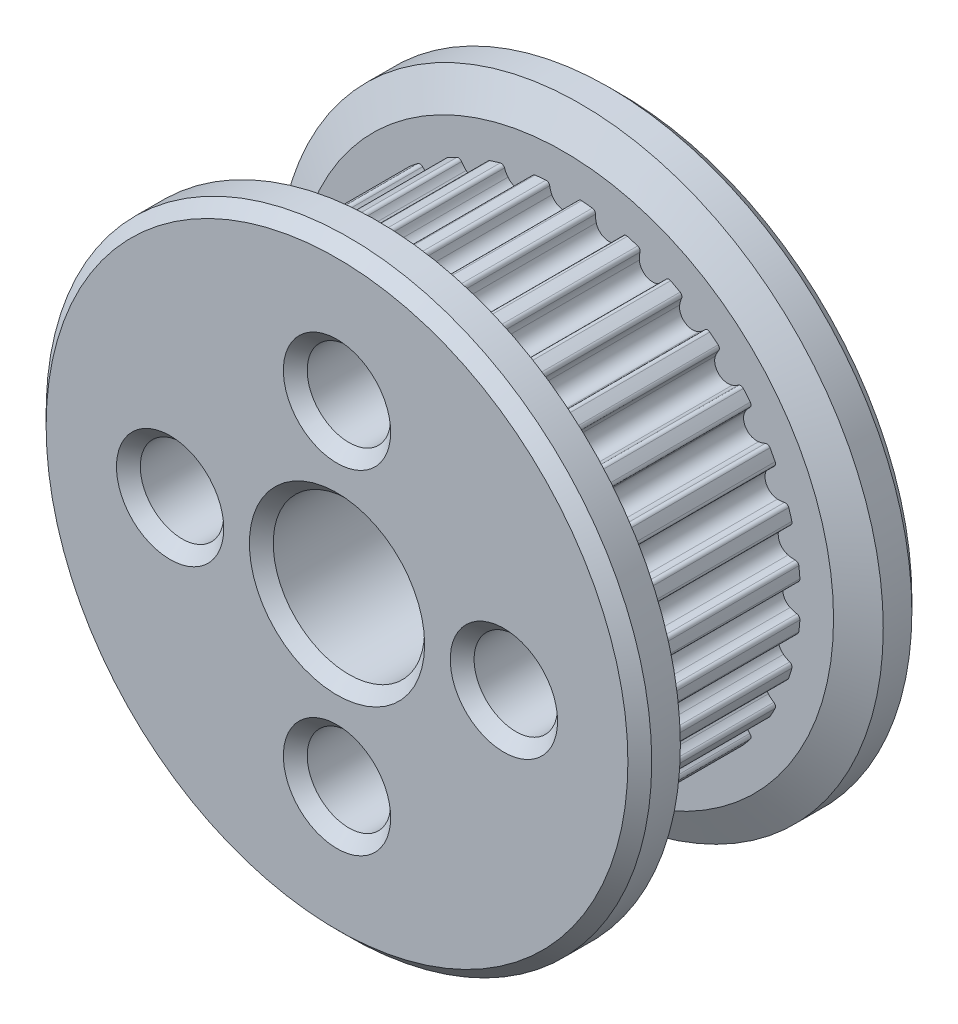
from build123d import *

# Parameters (mm, degrees)
CUT_EXTRUDE1_START  = -0.2149
CUT_EXTRUDE1_DEPTH  = 7.11
CIRPATTERN1_COUNT   = 32
SKETCH4_R           = 1.7526
CUT_EXTRUDE2_DEPTH  = 20.967570709
CUT_EXTRUDE3_DEPTH  = 1.31445
CIRPATTERN2_COUNT   = 2
CIRPATTERN2_ANGLE   = 90
CHAMFER1_SIZE       = 0.37975
SKETCH7_R           = 7.595
CUT_EXTRUDE4_DEPTH  = 21.51312024
SKETCH8_R           = 1.75
CUT_EXTRUDE5_DEPTH  = 21.513120192
BOSS_EXTRUDE1_START = 1
SKETCH9_R           = 12.7
SKETCH9_R_2         = 1.75
SKETCH9_R_3         = 3.175
BOSS_EXTRUDE1_DEPTH = 1
CHAMFER2_SIZE       = 0.5


with BuildPart() as part:
    # Sketch2 → Revolve1 (revolve)
    with BuildSketch(Plane(origin=(0, 0, 0), x_dir=(0, 0, -1), z_dir=(1, 0, 0)), mode=Mode.PRIVATE) as revolve1_sk:
        Polygon((-8.7249, 3.175), (8.7249, 3.175), (8.7249, 12.7), (8.0249, 12.7), (7.3249, 11.31575), (7.3249, 9.9315), (0.2149, 9.9315), (0.2149, 11.31575), (-0.4851, 12.7), (-1.1851, 12.7), (-1.1851, 7.595), (-8.7249, 7.595), align=None)
    revolve(revolve1_sk.sketch.rotate(Axis((0, 0, 8.7249), (0, 0, -1)), 90), axis=Axis((0, 0, 8.7249), (0, 0, -1)))

    # Sketch3 → Cut-Extrude1 (cut)
    with BuildSketch(Plane.XY.offset(CUT_EXTRUDE1_START)):
        with BuildLine():
            Line((2.530476216, 12.7), (-2.530476216, 12.7))
            Line((-2.530476216, 12.7), (-1.940703719, 9.740039082))
            ThreePointArc((-1.940703719, 9.740039082), (-1.346564619, 9.839789427), (-0.747470493, 9.903331768))
            ThreePointArc((-0.747470493, 9.903331768), (-0.643016659, 9.871317346), (-0.587983568, 9.776941049))
            ThreePointArc((-0.587983568, 9.776941049), (-0.554030146, 9.631789337), (-0.498876404, 9.493297753))
            ThreePointArc((-0.498876404, 9.493297753), (0, 9.1815), (0.498876404, 9.493297753))
            ThreePointArc((0.498876404, 9.493297753), (0.554030146, 9.631789337), (0.587983568, 9.776941049))
            ThreePointArc((0.587983568, 9.776941049), (0.643016659, 9.871317346), (0.747470493, 9.903331768))
            ThreePointArc((0.747470493, 9.903331768), (1.346564619, 9.839789427), (1.940703719, 9.740039082))
            Line((1.940703719, 9.740039082), (2.530476216, 12.7))
        make_face()
    cut_extrude1 = extrude(amount=-CUT_EXTRUDE1_DEPTH, mode=Mode.SUBTRACT)

    # CirPattern1: Cut-Extrude1 ×32 about axis
    cirpattern1_axis = Axis((0, 0, 0), (0, 0, 1))
    for i in range(1, CIRPATTERN1_COUNT):
        add(cut_extrude1.rotate(cirpattern1_axis, i * 360 / CIRPATTERN1_COUNT), mode=Mode.SUBTRACT)

    # Sketch4 → Cut-Extrude2 (cut, through all)
    with BuildSketch(Plane(origin=(0, 0, 0), x_dir=(0, -1, 0), z_dir=(1, 0, 0))):
        with Locations(Location((0, -4.955, 0), (0, 0, 270.000000003))):
            Circle(SKETCH4_R)
    cut_extrude2 = extrude(amount=CUT_EXTRUDE2_DEPTH, mode=Mode.SUBTRACT)

    # Sketch5 → Revolve2 (revolve)
    with BuildSketch(Plane.XY.offset(4.955), mode=Mode.PRIVATE) as revolve2_sk:
        Polygon((3.175, -1.3716), (3.175, 0), (7.390021532, 0), (7.390021532, -1.3716), (7.009021532, -1.7526), (3.556, -1.7526), align=None)
    revolve2 = revolve(revolve2_sk.sketch.rotate(Axis((3.175, 0, 4.955), (1, 0, 0)), 270), axis=Axis((3.175, 0, 4.955), (1, 0, 0)))

    # Sketch6 → Cut-Extrude3 (cut)
    with BuildSketch(Plane(origin=(7.390021532, 5.384140679, 0), x_dir=(0, -1, 0), z_dir=(-1, 0, 0))):
        Polygon((5.384140679, 5.966864082), (4.507840679, 5.460932041), (4.507840679, 4.449067959), (5.384140679, 3.943135918), (6.260440679, 4.449067959), (6.260440679, 5.460932041), align=None)
    cut_extrude3 = extrude(amount=CUT_EXTRUDE3_DEPTH, mode=Mode.SUBTRACT)

    # CirPattern2: Cut-Extrude2, Revolve2, Cut-Extrude3 ×2 about axis
    cirpattern2_axis = Axis((0, 0, 0), (0, 0, 1))
    add([cut_extrude2.rotate(cirpattern2_axis, i * CIRPATTERN2_ANGLE / (CIRPATTERN2_COUNT - 1)) for i in range(1, CIRPATTERN2_COUNT)], mode=Mode.SUBTRACT)
    add([revolve2.rotate(cirpattern2_axis, i * CIRPATTERN2_ANGLE / (CIRPATTERN2_COUNT - 1)) for i in range(1, CIRPATTERN2_COUNT)])
    add([cut_extrude3.rotate(cirpattern2_axis, i * CIRPATTERN2_ANGLE / (CIRPATTERN2_COUNT - 1)) for i in range(1, CIRPATTERN2_COUNT)], mode=Mode.SUBTRACT)

    # Chamfer1
    chamfer1_edges = [part.edges().sort_by_distance(p)[0] for p in [
        (-7.595, 0, 8.7249),
        (-3.175, 0, 8.7249),
    ]]
    chamfer(chamfer1_edges, length=CHAMFER1_SIZE)

    # Sketch7 → Cut-Extrude4 (cut, through all)
    with BuildSketch(Plane.XY.offset(1.1851)):
        Circle(SKETCH7_R)
    extrude(amount=CUT_EXTRUDE4_DEPTH, mode=Mode.SUBTRACT)

    # Sketch8 → Cut-Extrude5 (cut, through all)
    with BuildSketch(Plane.XY.offset(1.1851)):
        with Locations((0, 7)):
            Circle(SKETCH8_R)
        with Locations((7, 0)):
            Circle(SKETCH8_R)
        with Locations((0, -7)):
            Circle(SKETCH8_R)
        with Locations((-7, 0)):
            Circle(SKETCH8_R)
    extrude(amount=-CUT_EXTRUDE5_DEPTH, mode=Mode.SUBTRACT)

    # Sketch9 → Boss-Extrude1 (add)
    with BuildSketch(Plane.XY.offset(1.1851).offset(BOSS_EXTRUDE1_START)):
        Circle(SKETCH9_R)
        with Locations((0, 7)):
            Circle(SKETCH9_R_2, mode=Mode.SUBTRACT)
        with Locations((0, -7)):
            Circle(SKETCH9_R_2, mode=Mode.SUBTRACT)
        with Locations((7, 0)):
            Circle(SKETCH9_R_2, mode=Mode.SUBTRACT)
        Circle(SKETCH9_R_3, mode=Mode.SUBTRACT)
        with Locations((-7, 0)):
            Circle(SKETCH9_R_2, mode=Mode.SUBTRACT)
    boss_extrude1 = extrude(amount=-BOSS_EXTRUDE1_DEPTH)

    # Mirror1: Boss-Extrude1 across plane
    add(boss_extrude1.mirror(Plane.XY.offset(-3.7699)))

    # Chamfer2
    chamfer2_edges = [part.edges().sort_by_distance(p)[0] for p in [
        (-12.7, 0, 2.1851),
        (-1.75, 7, 2.1851),
        (-1.75, -7, 2.1851),
        (5.25, 0, 2.1851),
        (-3.175, 0, 2.1851),
        (-8.75, 0, 2.1851),
        (-12.7, 0, -9.7249),
        (-8.75, 0, -9.7249),
        (-3.175, 0, -9.7249),
        (5.25, 0, -9.7249),
        (-1.75, -7, -9.7249),
        (-1.75, 7, -9.7249),
    ]]
    chamfer(chamfer2_edges, length=CHAMFER2_SIZE)


solid = part.part
